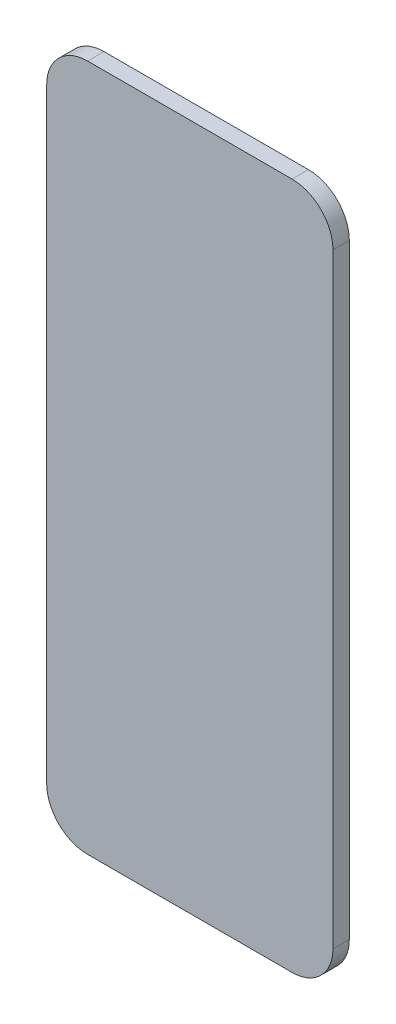
from build123d import *

# Parameters (mm, degrees)
SKETCH1_W           = 700
SKETCH1_H           = 1680
BOSS_EXTRUDE1_DEPTH = 40
FILLET1_R           = 100


with BuildPart() as part:
    # Sketch1 → Boss-Extrude1 (new body)
    with BuildSketch(Plane.XY):
        with Locations((350, 840)):
            Rectangle(SKETCH1_W, SKETCH1_H)
    extrude(amount=BOSS_EXTRUDE1_DEPTH)

    # Fillet1
    fillet1_edges = [part.edges().sort_by_distance(p)[0] for p in [
        (700, 0, 20),
        (0, 0, 20),
        (0, 1680, 20),
        (700, 1680, 20),
    ]]
    fillet(fillet1_edges, radius=FILLET1_R)


solid = part.part
